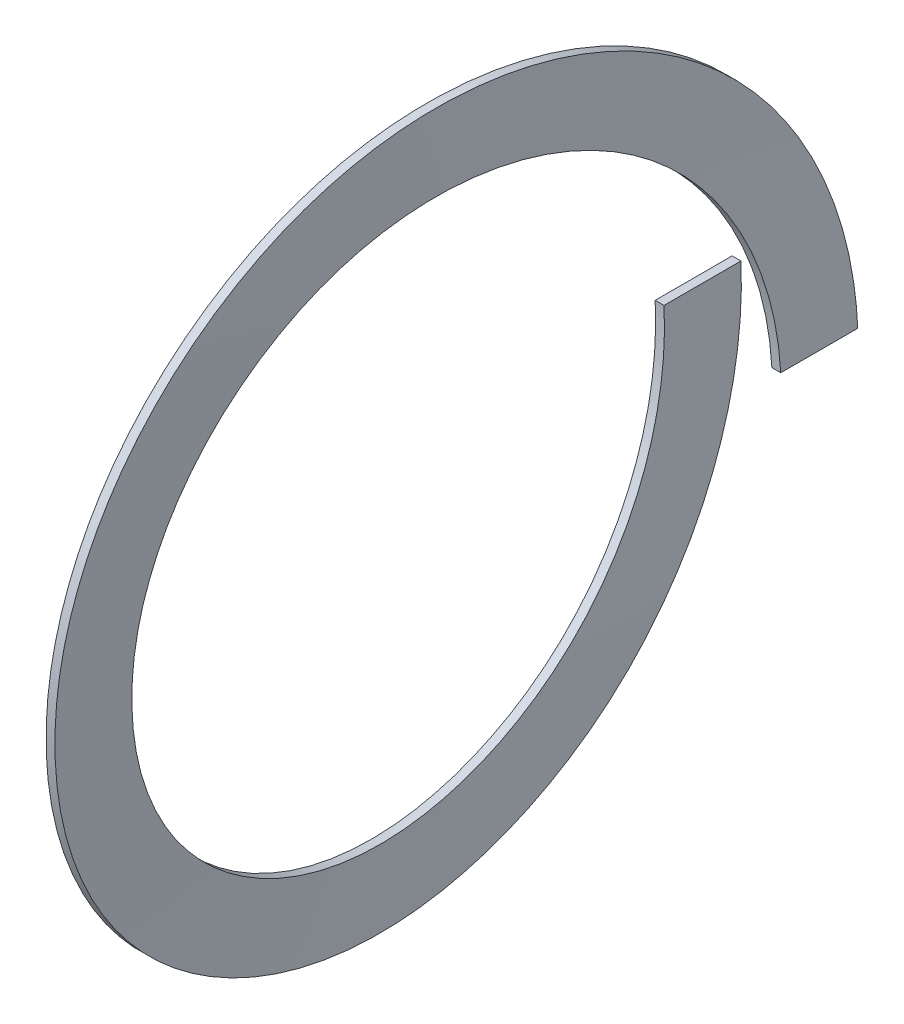
from build123d import *

# Parameters (mm, degrees)
SWEEP1_PITCH = 0.7


with BuildPart() as part:
    # Sweep1: the profile of Sketch4 screwed along a left-hand helix of 1 turns, 6 arcs to a turn; built about Z, then put on its axis
    sweep1_z = Axis((0, 0, 0), (0, 0, 1))
    sweep1_corners = [(1.769151995, 0, 0.026493031), (1.769151995, 0, -0.026493031), (2.230848005, 0, -0.026493031), (2.230848005, 0, 0.026493031)]
    with BuildLine(mode=Mode.PRIVATE) as sweep1_profile:
        Line(sweep1_corners[0], sweep1_corners[1])
        Line(sweep1_corners[1], sweep1_corners[2])
        Line(sweep1_corners[2], sweep1_corners[3])
        Line(sweep1_corners[3], sweep1_corners[0])
    sweep1_cap = Face(sweep1_profile.wire())
    sweep1_turn_angles = [0, -30, -60, -90, -120, -150, -180, -210, -240, -270, -300, -330, -360]
    sweep1_turn_weights = [1, 0.8660254037844387, 1, 0.8660254037844387, 1, 0.8660254037844387, 1, 0.8660254037844387, 1, 0.8660254037844387, 1, 0.8660254037844387, 1]
    sweep1_turn_rails = [Edge.make_bspline([Vector(p[0], p[1], 0).rotate(sweep1_z, sweep1_turn_angles[k]) / sweep1_turn_weights[k] + Vector(0, 0, p[2] + -SWEEP1_PITCH * sweep1_turn_angles[k] / 360) for k in range(13)], [0, 0, 0, 1, 1, 2, 2, 3, 3, 4, 4, 5, 5, 6, 6, 6], 2, sweep1_turn_weights) for p in sweep1_corners]
    sweep1_turn_sides = [Face.make_surface_from_curves(sweep1_turn_rails[p[0]], sweep1_turn_rails[p[1]]) for p in [(0, 1), (1, 2), (2, 3), (3, 0)]]
    sweep1 = Plane(origin=(0, 0, 0), x_dir=(0, 0, -1), z_dir=(1, 0, 0)) * Solid(Shell([*sweep1_turn_sides, sweep1_cap, sweep1_cap.rotate(sweep1_z, -360).moved(Location((0, 0, -SWEEP1_PITCH * -360 / 360)))]))
    add(sweep1)


solid = part.part
